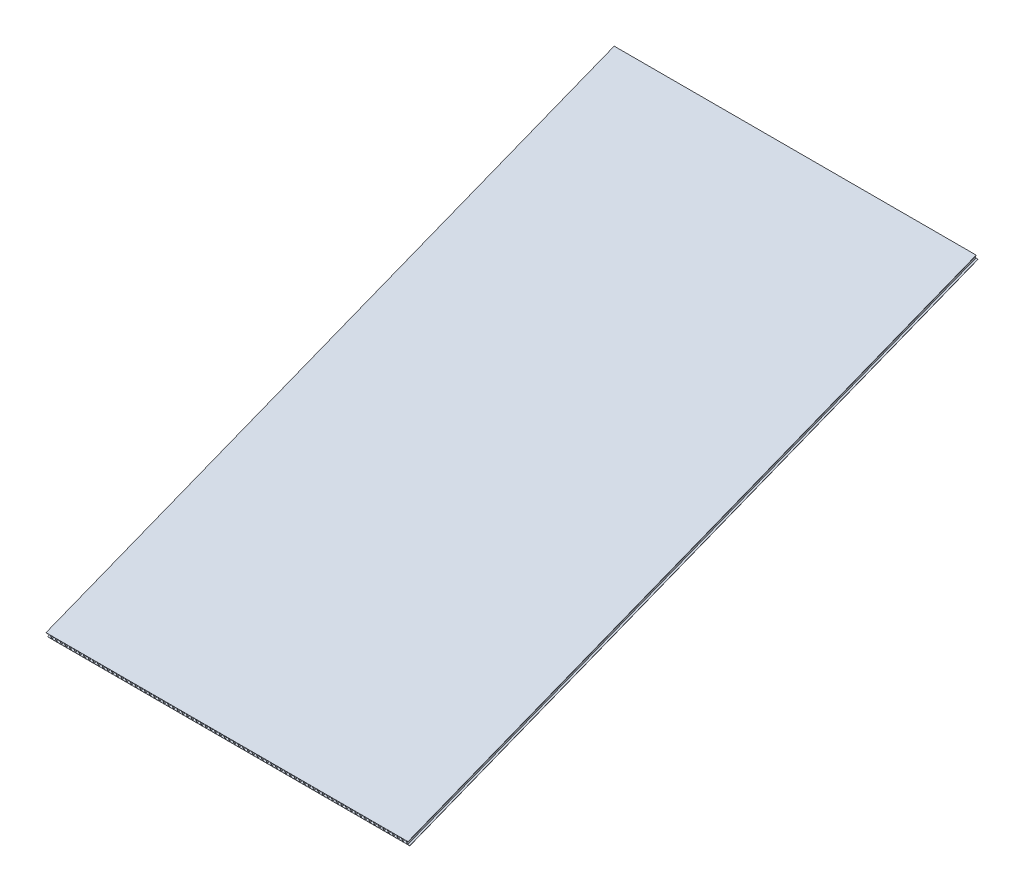
from build123d import *

# Parameters (mm, degrees)
EXTRUDE_THIN1_DEPTH = 1810
SKETCH2_W           = 9
SKETCH2_H           = 9
CUT_EXTRUDE1_DEPTH  = 2597.394169456
SKETCH3_W           = 2381.748177681
SKETCH3_H           = 2117.168842345
SKETCH3_W_2         = 735
SKETCH3_H_2         = 1240
CUT_EXTRUDE2_DEPTH  = 2326.943049171


with BuildPart() as part:
    # Sketch1 → Extrude-Thin1 (new body)
    with BuildSketch(Plane(origin=(0, 0, 0), x_dir=(0, 0, -1), z_dir=(1, 0, 0))):
        Polygon((0, 617), (-1566.345751625, 0), (-1570.010763892, 9.30417568), (-3.665012267, 626.30417568), align=None)
    extrude(amount=EXTRUDE_THIN1_DEPTH)

    # Sketch2 → Cut-Extrude1 (cut, through all)
    with BuildSketch(Plane(origin=(0, 82.87738305, -210.396494079), x_dir=(-1, 0, 0), z_dir=(0, 0.36650122672429875, -0.9304175679820241))):
        with Locations((-1805, 579.067639445)):
            Rectangle(SKETCH2_W, SKETCH2_H)
        with Locations((-1795.5, 579.067639445)):
            Rectangle(SKETCH2_W, SKETCH2_H)
        with Locations((-1786, 579.067639445)):
            Rectangle(SKETCH2_W, SKETCH2_H)
        with Locations((-1776.5, 579.067639445)):
            Rectangle(SKETCH2_W, SKETCH2_H)
        with Locations((-1767, 579.067639445)):
            Rectangle(SKETCH2_W, SKETCH2_H)
        with Locations((-1757.5, 579.067639445)):
            Rectangle(SKETCH2_W, SKETCH2_H)
        with Locations((-1748, 579.067639445)):
            Rectangle(SKETCH2_W, SKETCH2_H)
        with Locations((-1738.5, 579.067639445)):
            Rectangle(SKETCH2_W, SKETCH2_H)
        with Locations((-1729, 579.067639445)):
            Rectangle(SKETCH2_W, SKETCH2_H)
        with Locations((-1719.5, 579.067639445)):
            Rectangle(SKETCH2_W, SKETCH2_H)
        with Locations((-1710, 579.067639445)):
            Rectangle(SKETCH2_W, SKETCH2_H)
        with Locations((-1700.5, 579.067639445)):
            Rectangle(SKETCH2_W, SKETCH2_H)
        with Locations((-1691, 579.067639445)):
            Rectangle(SKETCH2_W, SKETCH2_H)
        with Locations((-1681.5, 579.067639445)):
            Rectangle(SKETCH2_W, SKETCH2_H)
        with Locations((-1672, 579.067639445)):
            Rectangle(SKETCH2_W, SKETCH2_H)
        with Locations((-1662.5, 579.067639445)):
            Rectangle(SKETCH2_W, SKETCH2_H)
        with Locations((-1653, 579.067639445)):
            Rectangle(SKETCH2_W, SKETCH2_H)
        with Locations((-1643.5, 579.067639445)):
            Rectangle(SKETCH2_W, SKETCH2_H)
        with Locations((-1634, 579.067639445)):
            Rectangle(SKETCH2_W, SKETCH2_H)
        with Locations((-1624.5, 579.067639445)):
            Rectangle(SKETCH2_W, SKETCH2_H)
        with Locations((-1615, 579.067639445)):
            Rectangle(SKETCH2_W, SKETCH2_H)
        with Locations((-1605.5, 579.067639445)):
            Rectangle(SKETCH2_W, SKETCH2_H)
        with Locations((-1596, 579.067639445)):
            Rectangle(SKETCH2_W, SKETCH2_H)
        with Locations((-1586.5, 579.067639445)):
            Rectangle(SKETCH2_W, SKETCH2_H)
        with Locations((-1577, 579.067639445)):
            Rectangle(SKETCH2_W, SKETCH2_H)
        with Locations((-1567.5, 579.067639445)):
            Rectangle(SKETCH2_W, SKETCH2_H)
        with Locations((-1558, 579.067639445)):
            Rectangle(SKETCH2_W, SKETCH2_H)
        with Locations((-1548.5, 579.067639445)):
            Rectangle(SKETCH2_W, SKETCH2_H)
        with Locations((-1539, 579.067639445)):
            Rectangle(SKETCH2_W, SKETCH2_H)
        with Locations((-1529.5, 579.067639445)):
            Rectangle(SKETCH2_W, SKETCH2_H)
        with Locations((-1520, 579.067639445)):
            Rectangle(SKETCH2_W, SKETCH2_H)
        with Locations((-1510.5, 579.067639445)):
            Rectangle(SKETCH2_W, SKETCH2_H)
        with Locations((-1501, 579.067639445)):
            Rectangle(SKETCH2_W, SKETCH2_H)
        with Locations((-1491.5, 579.067639445)):
            Rectangle(SKETCH2_W, SKETCH2_H)
        with Locations((-1482, 579.067639445)):
            Rectangle(SKETCH2_W, SKETCH2_H)
        with Locations((-1472.5, 579.067639445)):
            Rectangle(SKETCH2_W, SKETCH2_H)
        with Locations((-1463, 579.067639445)):
            Rectangle(SKETCH2_W, SKETCH2_H)
        with Locations((-1453.5, 579.067639445)):
            Rectangle(SKETCH2_W, SKETCH2_H)
        with Locations((-1444, 579.067639445)):
            Rectangle(SKETCH2_W, SKETCH2_H)
        with Locations((-1434.5, 579.067639445)):
            Rectangle(SKETCH2_W, SKETCH2_H)
        with Locations((-1425, 579.067639445)):
            Rectangle(SKETCH2_W, SKETCH2_H)
        with Locations((-1415.5, 579.067639445)):
            Rectangle(SKETCH2_W, SKETCH2_H)
        with Locations((-1406, 579.067639445)):
            Rectangle(SKETCH2_W, SKETCH2_H)
        with Locations((-1396.5, 579.067639445)):
            Rectangle(SKETCH2_W, SKETCH2_H)
        with Locations((-1387, 579.067639445)):
            Rectangle(SKETCH2_W, SKETCH2_H)
        with Locations((-1377.5, 579.067639445)):
            Rectangle(SKETCH2_W, SKETCH2_H)
        with Locations((-1368, 579.067639445)):
            Rectangle(SKETCH2_W, SKETCH2_H)
        with Locations((-1358.5, 579.067639445)):
            Rectangle(SKETCH2_W, SKETCH2_H)
        with Locations((-1349, 579.067639445)):
            Rectangle(SKETCH2_W, SKETCH2_H)
        with Locations((-1339.5, 579.067639445)):
            Rectangle(SKETCH2_W, SKETCH2_H)
        with Locations((-1330, 579.067639445)):
            Rectangle(SKETCH2_W, SKETCH2_H)
        with Locations((-1320.5, 579.067639445)):
            Rectangle(SKETCH2_W, SKETCH2_H)
        with Locations((-1311, 579.067639445)):
            Rectangle(SKETCH2_W, SKETCH2_H)
        with Locations((-1301.5, 579.067639445)):
            Rectangle(SKETCH2_W, SKETCH2_H)
        with Locations((-1292, 579.067639445)):
            Rectangle(SKETCH2_W, SKETCH2_H)
        with Locations((-1282.5, 579.067639445)):
            Rectangle(SKETCH2_W, SKETCH2_H)
        with Locations((-1273, 579.067639445)):
            Rectangle(SKETCH2_W, SKETCH2_H)
        with Locations((-1263.5, 579.067639445)):
            Rectangle(SKETCH2_W, SKETCH2_H)
        with Locations((-1254, 579.067639445)):
            Rectangle(SKETCH2_W, SKETCH2_H)
        with Locations((-1244.5, 579.067639445)):
            Rectangle(SKETCH2_W, SKETCH2_H)
        with Locations((-1235, 579.067639445)):
            Rectangle(SKETCH2_W, SKETCH2_H)
        with Locations((-1225.5, 579.067639445)):
            Rectangle(SKETCH2_W, SKETCH2_H)
        with Locations((-1216, 579.067639445)):
            Rectangle(SKETCH2_W, SKETCH2_H)
        with Locations((-1206.5, 579.067639445)):
            Rectangle(SKETCH2_W, SKETCH2_H)
        with Locations((-1197, 579.067639445)):
            Rectangle(SKETCH2_W, SKETCH2_H)
        with Locations((-1187.5, 579.067639445)):
            Rectangle(SKETCH2_W, SKETCH2_H)
        with Locations((-1178, 579.067639445)):
            Rectangle(SKETCH2_W, SKETCH2_H)
        with Locations((-1168.5, 579.067639445)):
            Rectangle(SKETCH2_W, SKETCH2_H)
        with Locations((-1159, 579.067639445)):
            Rectangle(SKETCH2_W, SKETCH2_H)
        with Locations((-1149.5, 579.067639445)):
            Rectangle(SKETCH2_W, SKETCH2_H)
        with Locations((-1140, 579.067639445)):
            Rectangle(SKETCH2_W, SKETCH2_H)
        with Locations((-1130.5, 579.067639445)):
            Rectangle(SKETCH2_W, SKETCH2_H)
        with Locations((-1121, 579.067639445)):
            Rectangle(SKETCH2_W, SKETCH2_H)
        with Locations((-1111.5, 579.067639445)):
            Rectangle(SKETCH2_W, SKETCH2_H)
        with Locations((-1102, 579.067639445)):
            Rectangle(SKETCH2_W, SKETCH2_H)
        with Locations((-1092.5, 579.067639445)):
            Rectangle(SKETCH2_W, SKETCH2_H)
        with Locations((-1083, 579.067639445)):
            Rectangle(SKETCH2_W, SKETCH2_H)
        with Locations((-1073.5, 579.067639445)):
            Rectangle(SKETCH2_W, SKETCH2_H)
        with Locations((-1064, 579.067639445)):
            Rectangle(SKETCH2_W, SKETCH2_H)
        with Locations((-1054.5, 579.067639445)):
            Rectangle(SKETCH2_W, SKETCH2_H)
        with Locations((-1045, 579.067639445)):
            Rectangle(SKETCH2_W, SKETCH2_H)
        with Locations((-1035.5, 579.067639445)):
            Rectangle(SKETCH2_W, SKETCH2_H)
        with Locations((-1026, 579.067639445)):
            Rectangle(SKETCH2_W, SKETCH2_H)
        with Locations((-1016.5, 579.067639445)):
            Rectangle(SKETCH2_W, SKETCH2_H)
        with Locations((-1007, 579.067639445)):
            Rectangle(SKETCH2_W, SKETCH2_H)
        with Locations((-997.5, 579.067639445)):
            Rectangle(SKETCH2_W, SKETCH2_H)
        with Locations((-988, 579.067639445)):
            Rectangle(SKETCH2_W, SKETCH2_H)
        with Locations((-978.5, 579.067639445)):
            Rectangle(SKETCH2_W, SKETCH2_H)
        with Locations((-969, 579.067639445)):
            Rectangle(SKETCH2_W, SKETCH2_H)
        with Locations((-959.5, 579.067639445)):
            Rectangle(SKETCH2_W, SKETCH2_H)
        with Locations((-950, 579.067639445)):
            Rectangle(SKETCH2_W, SKETCH2_H)
        with Locations((-940.5, 579.067639445)):
            Rectangle(SKETCH2_W, SKETCH2_H)
        with Locations((-931, 579.067639445)):
            Rectangle(SKETCH2_W, SKETCH2_H)
        with Locations((-921.5, 579.067639445)):
            Rectangle(SKETCH2_W, SKETCH2_H)
        with Locations((-912, 579.067639445)):
            Rectangle(SKETCH2_W, SKETCH2_H)
        with Locations((-902.5, 579.067639445)):
            Rectangle(SKETCH2_W, SKETCH2_H)
        with Locations((-893, 579.067639445)):
            Rectangle(SKETCH2_W, SKETCH2_H)
        with Locations((-883.5, 579.067639445)):
            Rectangle(SKETCH2_W, SKETCH2_H)
        with Locations((-874, 579.067639445)):
            Rectangle(SKETCH2_W, SKETCH2_H)
        with Locations((-864.5, 579.067639445)):
            Rectangle(SKETCH2_W, SKETCH2_H)
        with Locations((-855, 579.067639445)):
            Rectangle(SKETCH2_W, SKETCH2_H)
        with Locations((-845.5, 579.067639445)):
            Rectangle(SKETCH2_W, SKETCH2_H)
        with Locations((-836, 579.067639445)):
            Rectangle(SKETCH2_W, SKETCH2_H)
        with Locations((-826.5, 579.067639445)):
            Rectangle(SKETCH2_W, SKETCH2_H)
        with Locations((-817, 579.067639445)):
            Rectangle(SKETCH2_W, SKETCH2_H)
        with Locations((-807.5, 579.067639445)):
            Rectangle(SKETCH2_W, SKETCH2_H)
        with Locations((-798, 579.067639445)):
            Rectangle(SKETCH2_W, SKETCH2_H)
        with Locations((-788.5, 579.067639445)):
            Rectangle(SKETCH2_W, SKETCH2_H)
        with Locations((-779, 579.067639445)):
            Rectangle(SKETCH2_W, SKETCH2_H)
        with Locations((-769.5, 579.067639445)):
            Rectangle(SKETCH2_W, SKETCH2_H)
        with Locations((-760, 579.067639445)):
            Rectangle(SKETCH2_W, SKETCH2_H)
        with Locations((-750.5, 579.067639445)):
            Rectangle(SKETCH2_W, SKETCH2_H)
        with Locations((-741, 579.067639445)):
            Rectangle(SKETCH2_W, SKETCH2_H)
        with Locations((-731.5, 579.067639445)):
            Rectangle(SKETCH2_W, SKETCH2_H)
        with Locations((-722, 579.067639445)):
            Rectangle(SKETCH2_W, SKETCH2_H)
        with Locations((-712.5, 579.067639445)):
            Rectangle(SKETCH2_W, SKETCH2_H)
        with Locations((-703, 579.067639445)):
            Rectangle(SKETCH2_W, SKETCH2_H)
        with Locations((-693.5, 579.067639445)):
            Rectangle(SKETCH2_W, SKETCH2_H)
        with Locations((-684, 579.067639445)):
            Rectangle(SKETCH2_W, SKETCH2_H)
        with Locations((-674.5, 579.067639445)):
            Rectangle(SKETCH2_W, SKETCH2_H)
        with Locations((-665, 579.067639445)):
            Rectangle(SKETCH2_W, SKETCH2_H)
        with Locations((-655.5, 579.067639445)):
            Rectangle(SKETCH2_W, SKETCH2_H)
        with Locations((-646, 579.067639445)):
            Rectangle(SKETCH2_W, SKETCH2_H)
        with Locations((-636.5, 579.067639445)):
            Rectangle(SKETCH2_W, SKETCH2_H)
        with Locations((-627, 579.067639445)):
            Rectangle(SKETCH2_W, SKETCH2_H)
        with Locations((-617.5, 579.067639445)):
            Rectangle(SKETCH2_W, SKETCH2_H)
        with Locations((-608, 579.067639445)):
            Rectangle(SKETCH2_W, SKETCH2_H)
        with Locations((-598.5, 579.067639445)):
            Rectangle(SKETCH2_W, SKETCH2_H)
        with Locations((-589, 579.067639445)):
            Rectangle(SKETCH2_W, SKETCH2_H)
        with Locations((-579.5, 579.067639445)):
            Rectangle(SKETCH2_W, SKETCH2_H)
        with Locations((-570, 579.067639445)):
            Rectangle(SKETCH2_W, SKETCH2_H)
        with Locations((-560.5, 579.067639445)):
            Rectangle(SKETCH2_W, SKETCH2_H)
        with Locations((-551, 579.067639445)):
            Rectangle(SKETCH2_W, SKETCH2_H)
        with Locations((-541.5, 579.067639445)):
            Rectangle(SKETCH2_W, SKETCH2_H)
        with Locations((-532, 579.067639445)):
            Rectangle(SKETCH2_W, SKETCH2_H)
        with Locations((-522.5, 579.067639445)):
            Rectangle(SKETCH2_W, SKETCH2_H)
        with Locations((-513, 579.067639445)):
            Rectangle(SKETCH2_W, SKETCH2_H)
        with Locations((-503.5, 579.067639445)):
            Rectangle(SKETCH2_W, SKETCH2_H)
        with Locations((-494, 579.067639445)):
            Rectangle(SKETCH2_W, SKETCH2_H)
        with Locations((-484.5, 579.067639445)):
            Rectangle(SKETCH2_W, SKETCH2_H)
        with Locations((-475, 579.067639445)):
            Rectangle(SKETCH2_W, SKETCH2_H)
        with Locations((-465.5, 579.067639445)):
            Rectangle(SKETCH2_W, SKETCH2_H)
        with Locations((-456, 579.067639445)):
            Rectangle(SKETCH2_W, SKETCH2_H)
        with Locations((-446.5, 579.067639445)):
            Rectangle(SKETCH2_W, SKETCH2_H)
        with Locations((-437, 579.067639445)):
            Rectangle(SKETCH2_W, SKETCH2_H)
        with Locations((-427.5, 579.067639445)):
            Rectangle(SKETCH2_W, SKETCH2_H)
        with Locations((-418, 579.067639445)):
            Rectangle(SKETCH2_W, SKETCH2_H)
        with Locations((-408.5, 579.067639445)):
            Rectangle(SKETCH2_W, SKETCH2_H)
        with Locations((-399, 579.067639445)):
            Rectangle(SKETCH2_W, SKETCH2_H)
        with Locations((-389.5, 579.067639445)):
            Rectangle(SKETCH2_W, SKETCH2_H)
        with Locations((-380, 579.067639445)):
            Rectangle(SKETCH2_W, SKETCH2_H)
        with Locations((-370.5, 579.067639445)):
            Rectangle(SKETCH2_W, SKETCH2_H)
        with Locations((-361, 579.067639445)):
            Rectangle(SKETCH2_W, SKETCH2_H)
        with Locations((-351.5, 579.067639445)):
            Rectangle(SKETCH2_W, SKETCH2_H)
        with Locations((-342, 579.067639445)):
            Rectangle(SKETCH2_W, SKETCH2_H)
        with Locations((-332.5, 579.067639445)):
            Rectangle(SKETCH2_W, SKETCH2_H)
        with Locations((-323, 579.067639445)):
            Rectangle(SKETCH2_W, SKETCH2_H)
        with Locations((-313.5, 579.067639445)):
            Rectangle(SKETCH2_W, SKETCH2_H)
        with Locations((-304, 579.067639445)):
            Rectangle(SKETCH2_W, SKETCH2_H)
        with Locations((-294.5, 579.067639445)):
            Rectangle(SKETCH2_W, SKETCH2_H)
        with Locations((-285, 579.067639445)):
            Rectangle(SKETCH2_W, SKETCH2_H)
        with Locations((-275.5, 579.067639445)):
            Rectangle(SKETCH2_W, SKETCH2_H)
        with Locations((-266, 579.067639445)):
            Rectangle(SKETCH2_W, SKETCH2_H)
        with Locations((-256.5, 579.067639445)):
            Rectangle(SKETCH2_W, SKETCH2_H)
        with Locations((-247, 579.067639445)):
            Rectangle(SKETCH2_W, SKETCH2_H)
        with Locations((-237.5, 579.067639445)):
            Rectangle(SKETCH2_W, SKETCH2_H)
        with Locations((-228, 579.067639445)):
            Rectangle(SKETCH2_W, SKETCH2_H)
        with Locations((-218.5, 579.067639445)):
            Rectangle(SKETCH2_W, SKETCH2_H)
        with Locations((-209, 579.067639445)):
            Rectangle(SKETCH2_W, SKETCH2_H)
        with Locations((-199.5, 579.067639445)):
            Rectangle(SKETCH2_W, SKETCH2_H)
        with Locations((-190, 579.067639445)):
            Rectangle(SKETCH2_W, SKETCH2_H)
        with Locations((-180.5, 579.067639445)):
            Rectangle(SKETCH2_W, SKETCH2_H)
        with Locations((-171, 579.067639445)):
            Rectangle(SKETCH2_W, SKETCH2_H)
        with Locations((-161.5, 579.067639445)):
            Rectangle(SKETCH2_W, SKETCH2_H)
        with Locations((-152, 579.067639445)):
            Rectangle(SKETCH2_W, SKETCH2_H)
        with Locations((-142.5, 579.067639445)):
            Rectangle(SKETCH2_W, SKETCH2_H)
        with Locations((-133, 579.067639445)):
            Rectangle(SKETCH2_W, SKETCH2_H)
        with Locations((-123.5, 579.067639445)):
            Rectangle(SKETCH2_W, SKETCH2_H)
        with Locations((-114, 579.067639445)):
            Rectangle(SKETCH2_W, SKETCH2_H)
        with Locations((-104.5, 579.067639445)):
            Rectangle(SKETCH2_W, SKETCH2_H)
        with Locations((-95, 579.067639445)):
            Rectangle(SKETCH2_W, SKETCH2_H)
        with Locations((-85.5, 579.067639445)):
            Rectangle(SKETCH2_W, SKETCH2_H)
        with Locations((-76, 579.067639445)):
            Rectangle(SKETCH2_W, SKETCH2_H)
        with Locations((-66.5, 579.067639445)):
            Rectangle(SKETCH2_W, SKETCH2_H)
        with Locations((-57, 579.067639445)):
            Rectangle(SKETCH2_W, SKETCH2_H)
        with Locations((-47.5, 579.067639445)):
            Rectangle(SKETCH2_W, SKETCH2_H)
        with Locations((-38, 579.067639445)):
            Rectangle(SKETCH2_W, SKETCH2_H)
        with Locations((-28.5, 579.067639445)):
            Rectangle(SKETCH2_W, SKETCH2_H)
        with Locations((-19, 579.067639445)):
            Rectangle(SKETCH2_W, SKETCH2_H)
        with Locations((-9.5, 579.067639445)):
            Rectangle(SKETCH2_W, SKETCH2_H)
        with Locations((0, 579.067639445)):
            Rectangle(SKETCH2_W, SKETCH2_H)
    extrude(amount=-CUT_EXTRUDE1_DEPTH, mode=Mode.SUBTRACT)

    # Sketch3 → Cut-Extrude2 (cut, through all)
    with BuildSketch(Plane(origin=(0, 543.426792629, 214.061506347), x_dir=(1, 0, 0), z_dir=(0, 0.9304175679820244, 0.36650122672429813))):
        with Locations((864.414003859, -668.228060285)):
            Rectangle(SKETCH3_W, SKETCH3_H)
        with Locations((486.914003858, -584.351558452)):
            Rectangle(SKETCH3_W_2, SKETCH3_H_2, mode=Mode.SUBTRACT)
    extrude(amount=-CUT_EXTRUDE2_DEPTH, mode=Mode.SUBTRACT)


solid = part.part
